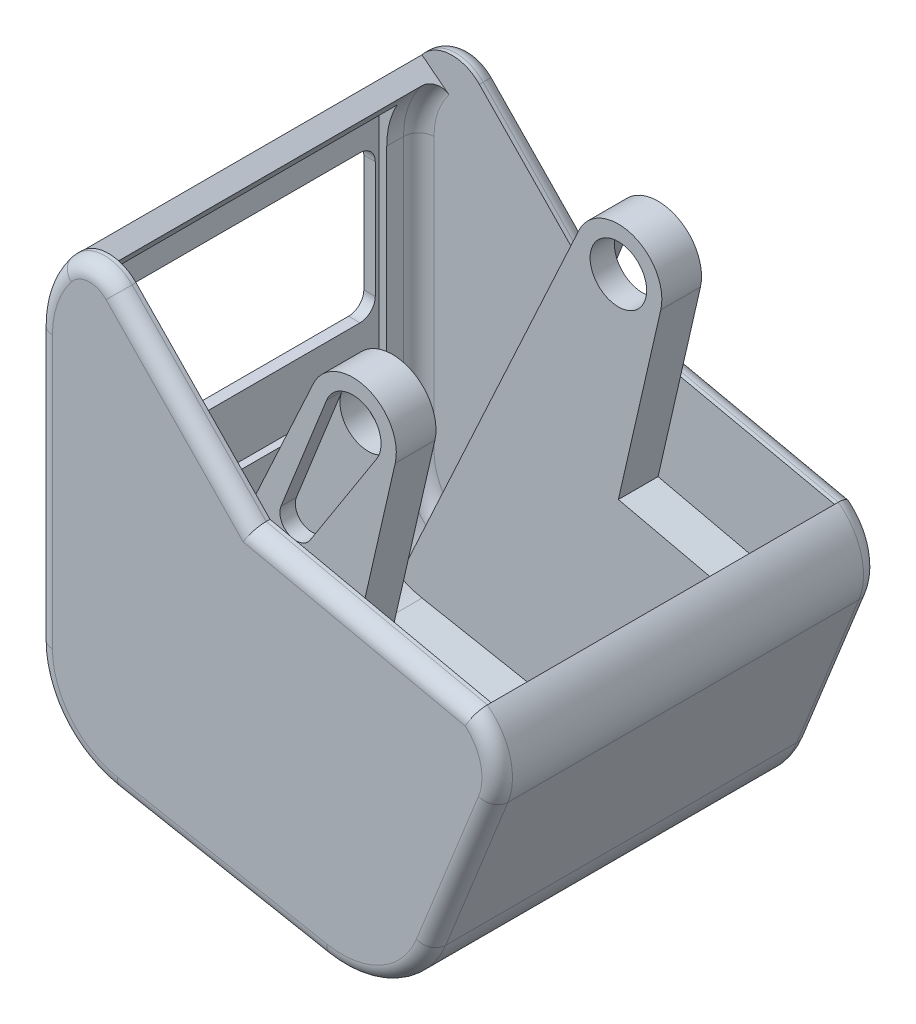
from build123d import *
from build123d.topology import SkipClean

# Parameters (mm, degrees)
EXTRUDE_1_DEPTH          = 25
CUT_EXTRUDE_1_DEPTH      = 50
FILLET_1_R               = 2
EXTRUDE_1_2_DEPTH        = 2.5
EXTRUDE_START            = -2.5
EXTRUDE_2_DEPTH          = 2.5
FILLET_2_R               = 2
EXTRUDE_3_DEPTH          = 0.5
CUT_EXTRUDE_2_DEPTH      = 4.500000000000001
CUT_EXTRUDE_2_DEPTH_BACK = 1
EXTRUDE_START_2          = -1.52
EXTRUDE_4_DEPTH          = 2.02
SKETCH_9_R               = 3.704999999999994
EXTRUDE_5_DEPTH          = 3.18


with BuildPart() as part:
    # 草图2 → Extrude 1 (new, symmetric)
    with BuildSketch(Plane.XY):
        with BuildLine():
            ThreePointArc((-0.1143477603855695, 17.839583821103602), (-1.8869359565435708, 14.56909935196978), (-2.5000000000000004, 10.900000000000004))
            Line((-2.5000000000000004, 10.900000000000004), (-2.500000000000004, -24.742133265754745))
            ThreePointArc((-2.500000000000004, -24.742133265754745), (-0.2025578009011335, -31.119484073400336), (5.634120664755489, -34.56651590825746))
            Line((5.634120664755489, -34.56651590825746), (33.076028649355315, -39.77837408717534))
            ThreePointArc((33.076028649355315, -39.77837408717534), (39.742250303094536, -38.726489015220594), (44.22215732758021, -33.67917226338634))
            Line((44.22215732758021, -33.67917226338634), (52.366937605779256, -13.388723153971922))
            ThreePointArc((52.366937605779256, -13.388723153971922), (52.57287151311585, -9.676187327369309), (50.481986509356446, -6.601527843938161))
            Line((50.481986509356446, -6.601527843938161), (51.989545354604594, -4.607219360249075))
            ThreePointArc((51.989545354604594, -4.607219360249075), (54.98170114836288, -9.00720318080403), (54.68699994152435, -14.32001835865034))
            Line((54.68699994152435, -14.320018358650337), (46.54221966332531, -34.610467468064755))
            ThreePointArc((46.5422196633253, -34.61046746806476), (40.942335882718204, -40.91961340785757), (32.60955881554419, -42.234469747801))
            Line((32.60955881554418, -42.234469747801), (5.16765083094436, -37.02261156888312))
            ThreePointArc((5.167650830944369, -37.02261156888313), (-2.1281972511264122, -32.71382177531172), (-5.0000000000000036, -24.742133265754727))
            Line((-5.0000000000000036, -24.742133265754745), (-5, 10.900000000000004))
            ThreePointArc((-4.999999999999998, 10.900000000000006), (-4.251134617918753, 15.381850660521048), (-2.0858960087441325, 19.37678826566987))
            Line((-2.0858960087441325, 19.37678826566987), (-0.1143477603855695, 17.839583821103602))
        make_face()
    extrude(amount=EXTRUDE_1_DEPTH, both=True)

    # 草图3 → 切除-拉伸1 (cut)
    with BuildSketch(Plane.ZY.offset(5.000000000000002)):
        Polygon((17.800000000000004, -8.400000000000004), (-17.800000000000008, -8.40000000000001), (-17.800000000000008, 10.900000000000004), (17.800000000000004, 10.900000000000007), align=None)
    extrude(amount=-CUT_EXTRUDE_1_DEPTH, mode=Mode.SUBTRACT)

    # 圆角1
    fillet_1_edges = [part.edges().sort_by_distance(p)[0] for p in [
        (-3.750000000000001, 10.900000000000007, 17.800000000000004),
        (-3.7500000000000027, -8.400000000000004, 17.800000000000004),
        (-3.7500000000000027, -8.40000000000001, -17.800000000000008),
        (-3.750000000000001, 10.900000000000004, -17.800000000000008),
    ]]
    fillet(fillet_1_edges, radius=FILLET_1_R)

    # 草图4 → Extrude 1 2 (add)
    with BuildSketch(Plane.XY.offset(25)):
        with BuildLine():
            Line((51.98954535460461, -4.607219360249135), (23.008969239206145, 1.708079669862409))
            Line((23.008969239206145, 1.708079669862409), (5.443234078147774, 19.7866817586704))
            ThreePointArc((5.443234078147774, 19.7866817586704), (1.585397896542812, 21.294986245828348), (-2.0858960087441325, 19.376788265669866))
            ThreePointArc((-2.0858960087441325, 19.376788265669866), (-4.251134617918748, 15.38185066052105), (-5.000000000000001, 10.900000000000006))
            Line((-5.000000000000001, 10.900000000000006), (-5.000000000000001, -24.74213326575473))
            ThreePointArc((-5.000000000000001, -24.74213326575473), (-2.1281972511264104, -32.71382177531172), (5.167650830944361, -37.02261156888312))
            Line((5.167650830944361, -37.02261156888312), (32.609558815544176, -42.234469747801))
            ThreePointArc((32.609558815544176, -42.234469747801), (40.9423358827182, -40.919613407857575), (46.542219663325305, -34.61046746806476))
            Line((46.542219663325305, -34.61046746806476), (54.68699994152435, -14.320018358650337))
            ThreePointArc((54.68699994152435, -14.320018358650337), (54.981701148362895, -9.007203180804034), (51.98954535460461, -4.607219360249135))
        make_face()
    extrude(amount=-EXTRUDE_1_2_DEPTH)

    # 草图5 → 凸台-拉伸2 (add)
    with BuildSketch(Plane(origin=(0, 0, -25), x_dir=(-1, 0, 0), z_dir=(0, 0, -1)).offset(EXTRUDE_START)):
        with BuildLine():
            Line((5.000000000000001, -24.74213326575473), (5.000000000000001, 10.900000000000006))
            ThreePointArc((5.000000000000001, 10.900000000000006), (4.251134617918748, 15.38185066052105), (2.085896008744129, 19.376788265669866))
            ThreePointArc((2.085896008744129, 19.376788265669866), (-1.5853978965428137, 21.294986245828348), (-5.443234078147774, 19.7866817586704))
            Line((-5.443234078147774, 19.7866817586704), (-23.008969239206145, 1.708079669862409))
            Line((-23.008969239206145, 1.708079669862409), (-51.98954535460461, -4.607219360249134))
            ThreePointArc((-51.98954535460461, -4.607219360249134), (-54.9817011483629, -9.007203180804034), (-54.68699994152435, -14.320018358650337))
            Line((-54.68699994152435, -14.320018358650337), (-46.542219663325305, -34.61046746806476))
            ThreePointArc((-46.542219663325305, -34.61046746806476), (-40.9423358827182, -40.91961340785757), (-32.609558815544176, -42.234469747801))
            Line((-32.609558815544176, -42.234469747801), (-5.167650830944367, -37.02261156888312))
            ThreePointArc((-5.167650830944367, -37.02261156888312), (2.1281972511264104, -32.71382177531172), (5.000000000000001, -24.74213326575473))
        make_face()
    extrude(amount=EXTRUDE_2_DEPTH)

    # 圆角2
    # the kernel refuses this fillet: 2 mm, written as the material it adds along each edge
    with BuildSketch(Plane(origin=(46.98455575181651, -11.228183614531638, 22.5), x_dir=(0.9280249342980426, -0.3725180818713555, 0), z_dir=(-0.3725180818713555, -0.9280249342980426, 0))) as fillet_2_piece_1:
        with BuildLine():
            CenterArc((5.799824611430273 - FILLET_2_R, -FILLET_2_R), FILLET_2_R, 0, 90)
            Line((5.799824611430273 - FILLET_2_R, 0), (5.799824611430273, 0))
            Line((5.799824611430273, 0), (5.799824611430272, -FILLET_2_R))
        make_face()
    revolve(axis=Axis((46.98455575181651, -11.228183614531638, 22.5), (0, 0, 1)), revolution_arc=74.78424706509949)
    with BuildSketch(Plane(origin=(52.366937605779256, -13.388723153971918, 22.5), x_dir=(-6.1e-16, 2.5e-16, -1), z_dir=(-0.37251808187136604, -0.9280249342980383, 0))) as fillet_2_piece_2:
        with BuildLine():
            CenterArc((FILLET_2_R, -FILLET_2_R), FILLET_2_R, 90.00000000000004, 89.99999999999996)
            Line((1.32e-15, -FILLET_2_R), (0, 0))
            Line((0, 0), (FILLET_2_R, 0))
        make_face()
    extrude(amount=21.86412062814045)
    with BuildSketch(Plane(origin=(34.941907984599844, -29.953991444672717, 22.5), x_dir=(-0.1865879335244535, -0.9824382642502653, 0), z_dir=(-0.9824382642502653, 0.1865879335244535, 0))) as fillet_2_piece_3:
        with BuildLine():
            CenterArc((9.999999999999966 - FILLET_2_R, -FILLET_2_R), FILLET_2_R, 0, 90)
            Line((9.999999999999966 - FILLET_2_R, 0), (9.999999999999966, 0))
            Line((9.999999999999966, 0), (9.999999999999966, -FILLET_2_R))
        make_face()
    revolve(axis=Axis((34.941907984599844, -29.953991444672717, 22.5), (0, 0, 1)), revolution_arc=78.88272850502351)
    with BuildSketch(Plane(origin=(33.076028649355315, -39.77837408717534, 22.5), x_dir=(1.2e-16, 6.5e-16, -1), z_dir=(-0.9824382642502657, 0.18658793352445166, 0))) as fillet_2_piece_4:
        with BuildLine():
            CenterArc((FILLET_2_R, -FILLET_2_R), FILLET_2_R, 90.00000000000004, 89.99999999999994)
            Line((1.33e-15, -FILLET_2_R), (0, 0))
            Line((0, 0), (FILLET_2_R, 0))
        make_face()
    extrude(amount=27.93245029553256)
    with BuildSketch(Plane(origin=(7.499999999999998, -24.7421332657548, 22.5), x_dir=(-1, 5.33e-15, 0), z_dir=(5.33e-15, 1, 0))) as fillet_2_piece_5:
        with BuildLine():
            CenterArc((10.000000000000002 - FILLET_2_R, -FILLET_2_R), FILLET_2_R, 0, 90)
            Line((10.000000000000002 - FILLET_2_R, 0), (10.000000000000002, 0))
            Line((10.000000000000002, 0), (10.000000000000002, -FILLET_2_R))
        make_face()
    revolve(axis=Axis((7.499999999999998, -24.7421332657548, 22.5), (0, 0, 1)), revolution_arc=79.24627352120132)
    with BuildSketch(Plane(origin=(-2.500000000000002, -24.742133265754745, 22.5), x_dir=(-8.9e-16, 0, -1), z_dir=(1e-16, 1, 0)), Plane(origin=(-2.4999999999999987, 10.900000000000007, -22.5), x_dir=(-8.9e-16, 0, 1), z_dir=(-1e-16, -1, 0))) as fillet_2_piece_6:
        with BuildLine():
            CenterArc((FILLET_2_R, -FILLET_2_R), FILLET_2_R, 89.99999999999994, 90.00000000000003)
            Line((-1.78e-15, -FILLET_2_R), (0, 0))
            Line((0, 0), (FILLET_2_R, 0))
        make_face()
    extrude(amount=35.64213326575475)
    with BuildSketch(Plane(origin=(8.786045661710352, 10.900000000000013, 22.5), x_dir=(-0.7886192993434255, 0.6148817778265061, 0), z_dir=(0.6148817778265061, 0.7886192993434255, 0))) as fillet_2_piece_7:
        with BuildLine():
            CenterArc((11.286045661710356 - FILLET_2_R, -FILLET_2_R), FILLET_2_R, 0, 90)
            Line((11.286045661710356, -FILLET_2_R), (11.286045661710356, 0))
            Line((11.286045661710356, 0), (11.286045661710356 - FILLET_2_R, 0))
        make_face()
    revolve(axis=Axis((8.786045661710352, 10.900000000000013, 22.5), (0, 0, 1)), revolution_arc=37.943330558398465)
    with BuildSketch(Plane(origin=(46.98455575181651, -11.228183614531638, -22.5), x_dir=(0.9280249342980426, -0.3725180818713555, 0), z_dir=(-0.3725180818713555, -0.9280249342980426, 0))) as fillet_2_piece_8:
        with BuildLine():
            CenterArc((5.799824611430273 - FILLET_2_R, FILLET_2_R), FILLET_2_R, 270, 90)
            Line((5.799824611430272, FILLET_2_R), (5.799824611430273, 0))
            Line((5.799824611430273, 0), (5.799824611430273 - FILLET_2_R, 0))
        make_face()
    revolve(axis=Axis((46.98455575181651, -11.228183614531638, -22.5), (0, 0, 1)), revolution_arc=74.78424706509949)
    with BuildSketch(Plane(origin=(44.22215732758021, -33.67917226338634, -22.5), x_dir=(-0.9280249342980382, 0.372518081871366, 0), z_dir=(0.37251808187136604, 0.9280249342980383, 0))) as fillet_2_piece_9:
        with BuildLine():
            CenterArc((FILLET_2_R, FILLET_2_R), FILLET_2_R, 180, 90)
            Line((0, FILLET_2_R), (0, 0))
            Line((0, 0), (FILLET_2_R, 0))
        make_face()
    extrude(amount=21.864120628140444)
    with BuildSketch(Plane(origin=(34.941907984599844, -29.953991444672717, -22.5), x_dir=(-0.1865879335244535, -0.9824382642502653, 0), z_dir=(-0.9824382642502653, 0.1865879335244535, 0))) as fillet_2_piece_10:
        with BuildLine():
            CenterArc((9.999999999999966 - FILLET_2_R, FILLET_2_R), FILLET_2_R, 270, 90)
            Line((9.999999999999966, FILLET_2_R), (9.999999999999966, 0))
            Line((9.999999999999966, 0), (9.999999999999966 - FILLET_2_R, 0))
        make_face()
    revolve(axis=Axis((34.941907984599844, -29.953991444672717, -22.5), (0, 0, 1)), revolution_arc=78.88272850502351)
    with BuildSketch(Plane(origin=(5.634120664755487, -34.56651590825746, -22.5), x_dir=(0.18658793352445166, 0.9824382642502656, 0), z_dir=(0.9824382642502657, -0.18658793352445166, 0))) as fillet_2_piece_11:
        with BuildLine():
            CenterArc((FILLET_2_R, FILLET_2_R), FILLET_2_R, 180, 90)
            Line((0, FILLET_2_R), (0, 0))
            Line((0, 0), (FILLET_2_R, 0))
        make_face()
    extrude(amount=27.93245029553256)
    with BuildSketch(Plane(origin=(7.499999999999998, -24.7421332657548, -22.5), x_dir=(-1, 5.33e-15, 0), z_dir=(5.33e-15, 1, 0))) as fillet_2_piece_12:
        with BuildLine():
            CenterArc((10.000000000000002 - FILLET_2_R, FILLET_2_R), FILLET_2_R, 270, 90)
            Line((10.000000000000002, FILLET_2_R), (10.000000000000002, 0))
            Line((10.000000000000002, 0), (10.000000000000002 - FILLET_2_R, 0))
        make_face()
    revolve(axis=Axis((7.499999999999998, -24.7421332657548, -22.5), (0, 0, 1)), revolution_arc=79.24627352120132)
    with BuildSketch(Plane(origin=(8.786045661710352, 10.900000000000013, -22.5), x_dir=(-0.7886192993434255, 0.6148817778265061, 0), z_dir=(0.6148817778265061, 0.7886192993434255, 0))) as fillet_2_piece_13:
        with BuildLine():
            CenterArc((11.286045661710356 - FILLET_2_R, FILLET_2_R), FILLET_2_R, 270, 90)
            Line((11.286045661710356, FILLET_2_R), (11.286045661710356, 0))
            Line((11.286045661710356, 0), (11.286045661710356 - FILLET_2_R, 0))
        make_face()
    revolve(axis=Axis((8.786045661710352, 10.900000000000013, -22.5), (0, 0, 1)), revolution_arc=37.94333055839848)
    # the kernel refuses this fillet: 2 mm, written as the material it takes off along each edge
    with BuildSketch(Plane(origin=(56.87489559276342, -5.671809915590321, 25), x_dir=(9e-17, 4.2e-16, -1), z_dir=(-0.9770700476317622, 0.21291811106823705, 0))) as fillet_2_2_piece_1_section:
        with BuildLine():
            CenterArc((FILLET_2_R, FILLET_2_R), FILLET_2_R, 179.99999999999994, 90.00000000000011)
            Line((-8.7e-16, FILLET_2_R), (0, 0))
            Line((0, 0), (FILLET_2_R, 0))
        make_face()
    fillet_2_2_piece_1 = extrude(amount=39.66069442579071, mode=Mode.PRIVATE)
    fillet_2_2_piece_1 = split(fillet_2_2_piece_1, bisect_by=Plane(origin=(33.44202855119758, -9.029593768854149, 24.542331946618905), z_dir=(0.7172067180349563, 0.6968604764266136, 0)), keep=Keep.TOP, mode=Mode.PRIVATE)
    add(fillet_2_2_piece_1, mode=Mode.SUBTRACT)
    with BuildSketch(Plane(origin=(26.49327162133921, -1.8779539203123712, 25), x_dir=(-1.7e-16, -1.6e-16, -1), z_dir=(-0.6968604764266136, 0.7172067180349563, 0))) as fillet_2_2_piece_2_section:
        with BuildLine():
            CenterArc((FILLET_2_R, FILLET_2_R), FILLET_2_R, 180, 90)
            Line((4.6e-16, FILLET_2_R), (0, 0))
            Line((0, 0), (FILLET_2_R, 0))
        make_face()
    fillet_2_2_piece_2 = extrude(amount=30.20696144389274, mode=Mode.PRIVATE)
    fillet_2_2_piece_2 = split(fillet_2_2_piece_2, bisect_by=Plane(origin=(12.234329507674772, 4.056034092003329, 24.540451573469035), z_dir=(0.21291811106823702, 0.9770700476317621, 0)), keep=Keep.TOP, mode=Mode.PRIVATE)
    add(fillet_2_2_piece_2, mode=Mode.SUBTRACT)
    with BuildSketch(Plane(origin=(1.8572004879729929, 16.302379376537328, 25), x_dir=(0.7172067180349557, 0.6968604764266142, 0), z_dir=(0.6968604764266142, -0.7172067180349557, 0))) as fillet_2_2_piece_3:
        with BuildLine():
            CenterArc((5.000000000000004 - FILLET_2_R, -FILLET_2_R), FILLET_2_R, 0, 90)
            Line((5.000000000000004 - FILLET_2_R, 0), (5.000000000000004, 0))
            Line((5.000000000000004, 0), (5.000000000000004, -FILLET_2_R))
        make_face()
    revolve(axis=Axis((1.8572004879729929, 16.302379376537328, 25), (0, 0, 1)), revolution_arc=97.88101027909731, mode=Mode.SUBTRACT)
    with BuildSketch(Plane(origin=(54.68699994152435, -14.320018358650337, -25), x_dir=(3.1e-16, -1.2e-16, 1), z_dir=(-0.37251808187136576, -0.9280249342980385, 0))) as fillet_2_2_piece_4:
        with BuildLine():
            CenterArc((FILLET_2_R, FILLET_2_R), FILLET_2_R, 180, 90)
            Line((-6.6e-16, FILLET_2_R), (0, 0))
            Line((0, 0), (FILLET_2_R, 0))
        make_face()
    extrude(amount=21.86412062814044, mode=Mode.SUBTRACT)
    with BuildSketch(Plane(origin=(34.941907984599844, -29.95399144467271, -25), x_dir=(0.9280249342980386, -0.3725180818713651, 0), z_dir=(0.3725180818713651, 0.9280249342980386, 0))) as fillet_2_2_piece_5:
        with BuildLine():
            CenterArc((12.499999999999968 - FILLET_2_R, -FILLET_2_R), FILLET_2_R, 0, 90.00000000000006)
            Line((12.499999999999968 - FILLET_2_R, 0), (12.499999999999968, 0))
            Line((12.499999999999968, 0), (12.499999999999972, -FILLET_2_R))
        make_face()
    revolve(axis=Axis((34.941907984599844, -29.95399144467271, -25), (0, 0, -1)), revolution_arc=78.88272850502337, mode=Mode.SUBTRACT)
    with BuildSketch(Plane(origin=(32.60955881554418, -42.234469747801, -25), x_dir=(0, 0, 1), z_dir=(-0.9824382642502657, 0.1865879335244517, 0))) as fillet_2_2_piece_6:
        with BuildLine():
            CenterArc((FILLET_2_R, FILLET_2_R), FILLET_2_R, 180, 90)
            Line((0, FILLET_2_R), (0, 0))
            Line((0, 0), (FILLET_2_R, 0))
        make_face()
    extrude(amount=27.932450295532554, mode=Mode.SUBTRACT)
    with BuildSketch(Plane(origin=(7.50000000000001, -24.742133265754795, -25), x_dir=(-0.18658793352445102, -0.9824382642502657, 0), z_dir=(0.9824382642502657, -0.18658793352445102, 0))) as fillet_2_2_piece_7:
        with BuildLine():
            CenterArc((12.500000000000018 - FILLET_2_R, -FILLET_2_R), FILLET_2_R, 0, 90)
            Line((12.500000000000018, -FILLET_2_R), (12.500000000000018, 0))
            Line((12.500000000000018, 0), (12.500000000000018 - FILLET_2_R, 0))
        make_face()
    revolve(axis=Axis((7.50000000000001, -24.742133265754795, -25), (0, 0, -1)), revolution_arc=79.2462735212013, mode=Mode.SUBTRACT)
    with BuildSketch(Plane(origin=(-5.0000000000000036, -24.742133265754745, -25), x_dir=(0, 0, 1), z_dir=(1e-16, 1, 0))) as fillet_2_2_piece_8:
        with BuildLine():
            CenterArc((FILLET_2_R, FILLET_2_R), FILLET_2_R, 180, 90)
            Line((0, FILLET_2_R), (0, 0))
            Line((0, 0), (FILLET_2_R, 0))
        make_face()
    extrude(amount=35.64213326575475, mode=Mode.SUBTRACT)
    with BuildSketch(Plane(origin=(8.78604566171035, 10.900000000000018, -25), x_dir=(-1, -9e-16, 0), z_dir=(9e-16, -1, 0))) as fillet_2_2_piece_9:
        with BuildLine():
            CenterArc((13.786045661710348 - FILLET_2_R, -FILLET_2_R), FILLET_2_R, 0, 90)
            Line((13.786045661710347, -FILLET_2_R), (13.786045661710348, 0))
            Line((13.786045661710348, 0), (13.786045661710348 - FILLET_2_R, 0))
        make_face()
    revolve(axis=Axis((8.78604566171035, 10.900000000000018, -25), (0, 0, -1)), revolution_arc=37.94333055839846, mode=Mode.SUBTRACT)
    with BuildSketch(Plane(origin=(18.12361900104733, 2.772670225203595, -25), x_dir=(-5e-17, -2.1e-16, 1), z_dir=(0.9770700476317622, -0.21291811106823702, 0))) as fillet_2_2_piece_10_section:
        with BuildLine():
            CenterArc((FILLET_2_R, FILLET_2_R), FILLET_2_R, 180.00000000000003, 89.99999999999994)
            Line((4.3e-16, FILLET_2_R), (0, 0))
            Line((0, 0), (FILLET_2_R, 0))
        make_face()
    fillet_2_2_piece_10 = extrude(amount=39.66069442579071, mode=Mode.PRIVATE)
    fillet_2_2_piece_10 = split(fillet_2_2_piece_10, bisect_by=Plane(origin=(33.44202855119865, -9.029593768855253, -24.542331946618965), z_dir=(0.7172067180349563, 0.6968604764266136, 0)), keep=Keep.TOP, mode=Mode.PRIVATE)
    add(fillet_2_2_piece_10, mode=Mode.SUBTRACT)
    with BuildSketch(Plane(origin=(1.8572004879729944, 16.30237937653733, -25), x_dir=(-0.7886192993434248, 0.614881777826507, 0), z_dir=(-0.614881777826507, -0.7886192993434248, 0))) as fillet_2_2_piece_11:
        with BuildLine():
            CenterArc((5.000000000000001 - FILLET_2_R, -FILLET_2_R), FILLET_2_R, 0, 90.00000000000006)
            Line((5.000000000000001 - FILLET_2_R, 0), (5.000000000000001, 0))
            Line((5.000000000000001, 0), (5.000000000000001, -FILLET_2_R))
        make_face()
    revolve(axis=Axis((1.8572004879729944, 16.30237937653733, -25), (0, 0, -1)), revolution_arc=97.88101027909734, mode=Mode.SUBTRACT)
    with BuildSketch(Plane(origin=(5.443234078147774, 19.7866817586704, -25), x_dir=(2.3e-16, 2.2e-16, 1), z_dir=(0.6968604764266136, -0.7172067180349563, 0))) as fillet_2_2_piece_12_section:
        with BuildLine():
            CenterArc((FILLET_2_R, FILLET_2_R), FILLET_2_R, 180.00000000000009, 89.99999999999994)
            Line((-6.4e-16, FILLET_2_R), (0, 0))
            Line((0, 0), (FILLET_2_R, 0))
        make_face()
    fillet_2_2_piece_12 = extrude(amount=30.20696144389274, mode=Mode.PRIVATE)
    fillet_2_2_piece_12 = split(fillet_2_2_piece_12, bisect_by=Plane(origin=(12.234329507675643, 4.056034092003141, -24.54045157346901), z_dir=(0.21291811106823702, 0.9770700476317622, 0)), keep=Keep.TOP, mode=Mode.PRIVATE)
    add(fillet_2_2_piece_12, mode=Mode.SUBTRACT)
    with BuildSketch(Plane(origin=(46.98455575181643, -11.228183614531627, -25), x_dir=(0.04468158891705533, 0.9990012790841898, 0), z_dir=(-0.9990012790841898, 0.04468158891705533, 0))) as fillet_2_2_piece_13:
        with BuildLine():
            CenterArc((8.299824611430347 - FILLET_2_R, -FILLET_2_R), FILLET_2_R, 0, 89.99999999999997)
            Line((8.299824611430347 - FILLET_2_R, 0), (8.299824611430347, 0))
            Line((8.299824611430347, 0), (8.299824611430347, -FILLET_2_R))
        make_face()
    revolve(axis=Axis((46.98455575181643, -11.228183614531627, -25), (0, 0, -1)), revolution_arc=109.3100789022987, mode=Mode.SUBTRACT)
    with BuildSketch(Plane(origin=(8.78604566171035, 10.900000000000018, 25), x_dir=(-1, -9e-16, 0), z_dir=(9e-16, -1, 0))) as fillet_2_2_piece_14:
        with BuildLine():
            CenterArc((13.786045661710348 - FILLET_2_R, FILLET_2_R), FILLET_2_R, 270, 90)
            Line((13.786045661710347, FILLET_2_R), (13.786045661710348, 0))
            Line((13.786045661710348, 0), (13.786045661710348 - FILLET_2_R, 0))
        make_face()
    revolve(axis=Axis((8.78604566171035, 10.900000000000018, 25), (0, 0, -1)), revolution_arc=37.94333055839846, mode=Mode.SUBTRACT)
    with BuildSketch(Plane(origin=(-5.0000000000000036, -24.742133265754745, 25), x_dir=(0, 0, -1), z_dir=(1e-16, 1, 0))) as fillet_2_2_piece_15:
        with BuildLine():
            CenterArc((FILLET_2_R, -FILLET_2_R), FILLET_2_R, 90, 90)
            Line((0, -FILLET_2_R), (0, 0))
            Line((0, 0), (FILLET_2_R, 0))
        make_face()
    extrude(amount=35.64213326575475, mode=Mode.SUBTRACT)
    with BuildSketch(Plane(origin=(46.98455575181643, -11.228183614531627, 25), x_dir=(0.04468158891705533, 0.9990012790841898, 0), z_dir=(-0.9990012790841898, 0.04468158891705533, 0))) as fillet_2_2_piece_16:
        with BuildLine():
            CenterArc((8.299824611430347 - FILLET_2_R, FILLET_2_R), FILLET_2_R, 270, 90)
            Line((8.299824611430347 - FILLET_2_R, 0), (8.299824611430347, 0))
            Line((8.299824611430347, 0), (8.299824611430347, FILLET_2_R))
        make_face()
    revolve(axis=Axis((46.98455575181643, -11.228183614531627, 25), (0, 0, -1)), revolution_arc=109.3100789022987, mode=Mode.SUBTRACT)
    with BuildSketch(Plane(origin=(7.50000000000001, -24.742133265754795, 25), x_dir=(-0.18658793352445102, -0.9824382642502657, 0), z_dir=(0.9824382642502657, -0.18658793352445102, 0))) as fillet_2_2_piece_17:
        with BuildLine():
            CenterArc((12.500000000000018 - FILLET_2_R, FILLET_2_R), FILLET_2_R, 270, 90)
            Line((12.500000000000018 - FILLET_2_R, 0), (12.500000000000018, 0))
            Line((12.500000000000018, 0), (12.500000000000018, FILLET_2_R))
        make_face()
    revolve(axis=Axis((7.50000000000001, -24.742133265754795, 25), (0, 0, -1)), revolution_arc=79.2462735212013, mode=Mode.SUBTRACT)
    with BuildSketch(Plane(origin=(32.60955881554418, -42.234469747801, 25), x_dir=(0, 0, -1), z_dir=(-0.9824382642502657, 0.1865879335244517, 0))) as fillet_2_2_piece_18:
        with BuildLine():
            CenterArc((FILLET_2_R, -FILLET_2_R), FILLET_2_R, 90, 90)
            Line((0, -FILLET_2_R), (0, 0))
            Line((0, 0), (FILLET_2_R, 0))
        make_face()
    extrude(amount=27.932450295532554, mode=Mode.SUBTRACT)
    with BuildSketch(Plane(origin=(34.941907984599844, -29.95399144467271, 25), x_dir=(0.9280249342980386, -0.3725180818713651, 0), z_dir=(0.3725180818713651, 0.9280249342980386, 0))) as fillet_2_2_piece_19:
        with BuildLine():
            CenterArc((12.499999999999968 - FILLET_2_R, FILLET_2_R), FILLET_2_R, 269.99999999999994, 90.00000000000006)
            Line((12.499999999999968 - FILLET_2_R, 0), (12.499999999999968, 0))
            Line((12.499999999999968, 0), (12.499999999999972, FILLET_2_R))
        make_face()
    revolve(axis=Axis((34.941907984599844, -29.95399144467271, 25), (0, 0, -1)), revolution_arc=78.88272850502337, mode=Mode.SUBTRACT)
    with BuildSketch(Plane(origin=(54.68699994152435, -14.320018358650337, 25), x_dir=(3.1e-16, -1.2e-16, -1), z_dir=(-0.37251808187136576, -0.9280249342980385, 0))) as fillet_2_2_piece_20:
        with BuildLine():
            CenterArc((FILLET_2_R, -FILLET_2_R), FILLET_2_R, 89.99999999999999, 90.00000000000001)
            Line((-6.6e-16, -FILLET_2_R), (0, 0))
            Line((0, 0), (FILLET_2_R, 0))
        make_face()
    extrude(amount=21.86412062814044, mode=Mode.SUBTRACT)
    with BuildSketch(Plane(origin=(56.87489559276342, -5.671809915590321, 25), x_dir=(9e-17, 4.2e-16, -1), z_dir=(-0.9770700476317622, 0.21291811106823705, 0))) as fillet_2_2_piece_21a_section:
        with BuildLine():
            CenterArc((FILLET_2_R, FILLET_2_R), FILLET_2_R, 179.99999999999994, 90.00000000000011)
            Line((-8.7e-16, FILLET_2_R), (0, 0))
            Line((0, 0), (FILLET_2_R, 0))
        make_face()
    fillet_2_2_piece_21a = extrude(amount=39.66069442579071, mode=Mode.PRIVATE)
    fillet_2_2_piece_21a = split(fillet_2_2_piece_21a, bisect_by=Plane(origin=(21.970126163217714, 2.777253856499559, 24.576371724021378), z_dir=(-0.7172067180349563, -0.6968604764266136, 0)), keep=Keep.TOP, mode=Mode.PRIVATE)
    with BuildSketch(Plane(origin=(26.49327162133921, -1.8779539203123712, 25), x_dir=(-1.7e-16, -1.6e-16, -1), z_dir=(-0.6968604764266136, 0.7172067180349563, 0))) as fillet_2_2_piece_21b_section:
        with BuildLine():
            CenterArc((FILLET_2_R, FILLET_2_R), FILLET_2_R, 180, 90)
            Line((4.6e-16, FILLET_2_R), (0, 0))
            Line((0, 0), (FILLET_2_R, 0))
        make_face()
    fillet_2_2_piece_21b = extrude(amount=30.20696144389274, mode=Mode.PRIVATE)
    fillet_2_2_piece_21b = split(fillet_2_2_piece_21b, bisect_by=Plane(origin=(24.465534058238404, 1.3906725088625471, 24.576371724021076), z_dir=(-0.21291811106823702, -0.9770700476317621, 0)), keep=Keep.TOP, mode=Mode.PRIVATE)
    fillet_2_2_piece_21 = fillet_2_2_piece_21a & fillet_2_2_piece_21b
    add(fillet_2_2_piece_21, mode=Mode.SUBTRACT)
    with BuildSketch(Plane(origin=(18.12361900104733, 2.772670225203595, -25), x_dir=(-5e-17, -2.1e-16, 1), z_dir=(0.9770700476317622, -0.21291811106823702, 0))) as fillet_2_2_piece_22a_section:
        with BuildLine():
            CenterArc((FILLET_2_R, FILLET_2_R), FILLET_2_R, 180.00000000000003, 89.99999999999994)
            Line((4.3e-16, FILLET_2_R), (0, 0))
            Line((0, 0), (FILLET_2_R, 0))
        make_face()
    fillet_2_2_piece_22a = extrude(amount=39.66069442579071, mode=Mode.PRIVATE)
    fillet_2_2_piece_22a = split(fillet_2_2_piece_22a, bisect_by=Plane(origin=(21.97012616321881, 2.777253856498433, -24.576371724021083), z_dir=(-0.7172067180349563, -0.6968604764266136, 0)), keep=Keep.TOP, mode=Mode.PRIVATE)
    with BuildSketch(Plane(origin=(5.443234078147774, 19.7866817586704, -25), x_dir=(2.3e-16, 2.2e-16, 1), z_dir=(0.6968604764266136, -0.7172067180349563, 0))) as fillet_2_2_piece_22b_section:
        with BuildLine():
            CenterArc((FILLET_2_R, FILLET_2_R), FILLET_2_R, 180.00000000000009, 89.99999999999994)
            Line((-6.4e-16, FILLET_2_R), (0, 0))
            Line((0, 0), (FILLET_2_R, 0))
        make_face()
    fillet_2_2_piece_22b = extrude(amount=30.20696144389274, mode=Mode.PRIVATE)
    fillet_2_2_piece_22b = split(fillet_2_2_piece_22b, bisect_by=Plane(origin=(24.46553405823951, 1.3906725088623069, -24.576371724021204), z_dir=(-0.21291811106823702, -0.9770700476317622, 0)), keep=Keep.TOP, mode=Mode.PRIVATE)
    fillet_2_2_piece_22 = fillet_2_2_piece_22a & fillet_2_2_piece_22b
    add(fillet_2_2_piece_22, mode=Mode.SUBTRACT)

    # 草图6 → 凸台-拉伸3 (add)
    with BuildSketch(Plane.ZY.offset(5.000000000000002)):
        Polygon((-5, -22.210339253873833), (5, -22.210339253873833), (5, -20.210339253873833), (1, -20.210339253873833), (1, -11.210339253873835), (-1, -11.210339253873835), (-1.0000000000000018, -20.210339253873833), (-5, -20.210339253873833), align=None)
    extrude(amount=EXTRUDE_3_DEPTH)

    # 草图7 → 切除-拉伸2 (cut, two sides: drawn at the far end of the back side and taken through both)
    with BuildSketch(Plane(origin=(-2.5000000000000013, 2.4e-16, 0), x_dir=(0, 0, -1), z_dir=(1, -1e-16, 0)).offset(-CUT_EXTRUDE_2_DEPTH_BACK)):
        Polygon((18.3043805238656, -16.260815752557356), (-18.30697882961367, -16.260815752557356), (-18.30697882961367, 16.23752462792765), (18.3043805238656, 16.23752462792766), align=None)
    extrude(amount=CUT_EXTRUDE_2_DEPTH + CUT_EXTRUDE_2_DEPTH_BACK, mode=Mode.SUBTRACT)

    # 草图8 → 凸台-拉伸4 (add)
    with BuildSketch(Plane(origin=(-1.08e-15, -3.35e-15, -19.499999999999986), x_dir=(-1, 0, 6e-17), z_dir=(-6e-17, -1.7e-16, -1)).offset(EXTRUDE_START_2)):
        with BuildLine():
            Line((-32.982734682593076, -40.26959321930046), (-5.540826697993263, -35.05773504038258))
            ThreePointArc((-5.540826697993263, -35.05773504038258), (-3.970283828680571, -34.63107171990274), (-2.484538876463882, -33.96683649774538))
            Line((-2.484538876463882, -33.96683649774538), (-26.181613568562078, 17.43416406828128))
            ThreePointArc((-26.181613568562078, 17.43416406828128), (-33.19635447926454, 20.443171958724264), (-36.91459390335908, 13.777182601236504))
            Line((-36.91459390335908, 13.777182601236504), (-31.358008918069267, -10.523321558417592))
            Line((-31.358008918069267, -10.523321558417592), (-52.147696250107515, -15.277118587446726))
            Line((-52.147696250107515, -15.277118587446726), (-44.68616979472923, -33.865431304322016))
            ThreePointArc((-44.68616979472923, -33.865431304322016), (-39.98226741901926, -39.16511389374798), (-32.982734682593076, -40.26959321930046))
        make_face()
        with BuildLine():
            ThreePointArc((-25.762615488137158, -0.527946783394179), (-22.970870904823684, -1.2789661729794597), (-21.955426852408642, 1.4278292235010557))
            Line((-21.955426852408642, 1.4278292235010557), (-27.915175480361775, 16.41667161681518))
            ThreePointArc((-27.915175480361775, 16.41667161681518), (-33.05097248870805, 18.3433464343197), (-34.475935431698595, 13.046369242142225))
            Line((-34.475935431698595, 13.046369242142225), (-25.762615488137158, -0.527946783394179))
        make_face(mode=Mode.SUBTRACT)
    extrude_4 = extrude(amount=EXTRUDE_4_DEPTH)

    # 草图9 → 凸台-拉伸5 (add)
    with SkipClean():  # the faces are left unmerged after this step: merging them gives an invalid solid
        with BuildSketch(Plane.XY.offset(-17.979999999999986)):
            with BuildLine():
                Line((44.22215732758021, -33.67917226338634), (51.65421289759475, -15.164278040228142))
                Line((51.65421289759475, -15.164278040228142), (31.358008918069267, -10.523321558417592))
                Line((31.358008918069267, -10.523321558417592), (36.91459390335908, 13.777182601236513))
                ThreePointArc((36.91459390335908, 13.777182601236513), (33.19635447926454, 20.44317195872426), (26.181613568562085, 17.434164068281287))
                Line((26.181613568562085, 17.434164068281287), (2.6943550395984537, -33.511727128332886))
                ThreePointArc((2.6943550395984537, -33.511727128332886), (4.122803833146113, -34.15460085138756), (5.63412066475549, -34.56651590825746))
                Line((5.63412066475549, -34.56651590825746), (33.076028649355315, -39.77837408717534))
                ThreePointArc((33.076028649355315, -39.77837408717534), (39.74225030309453, -38.726489015220594), (44.22215732758021, -33.67917226338634))
            make_face()
            with Locations(Location((31.358008918069267, 15.047758573483645, 0), (0, 0, 327.303694731))):
                Circle(SKETCH_9_R, mode=Mode.SUBTRACT)
        extrude_5 = extrude(amount=EXTRUDE_5_DEPTH)

    # 镜向2: 凸台-拉伸4, 凸台-拉伸5 across plane
    with SkipClean():  # the faces are left unmerged after this step: merging them gives an invalid solid
        add(extrude_4.mirror(Plane.XY))
        add(extrude_5.mirror(Plane.XY))


solid = part.part
